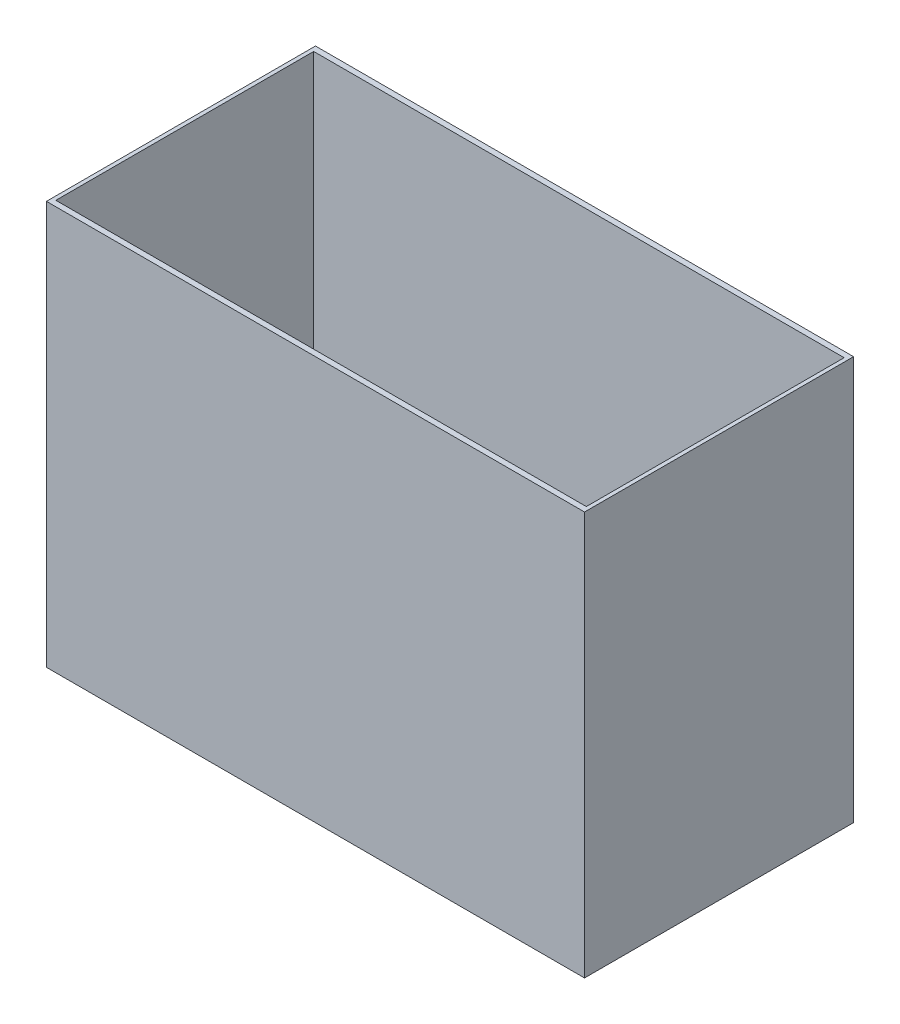
from build123d import *

# Parameters (mm, degrees)
SKETCH1_W           = 584.2
SKETCH1_H           = 279.4
BOSS_EXTRUDE1_DEPTH = 12.7
SKETCH3_W           = 609.6
SKETCH3_H           = 304.8
SKETCH3_W_2         = 600.964
SKETCH3_H_2         = 292.1
BOSS_EXTRUDE3_DEPTH = 457.2
SKETCH4_R           = 2.778125
CUT_EXTRUDE1_DEPTH  = 561.097357608
SKETCH6_R           = 6.35
CUT_EXTRUDE2_DEPTH  = 2.54


with BuildPart() as part:
    # Sketch1 → Boss-Extrude1 (new body)
    with BuildSketch(Plane(origin=(0, 0, 0), x_dir=(1, 0, 0), z_dir=(0, 1, 0))):
        Rectangle(SKETCH1_W, SKETCH1_H)
    extrude(amount=BOSS_EXTRUDE1_DEPTH)

    # Sketch4 → Cut-Extrude1 (cut, through all)
    with BuildSketch(Plane(origin=(0, 12.7, 0), x_dir=(1, 0, 0), z_dir=(0, 1, 0))):
        with Locations((254, 101.6)):
            Circle(SKETCH4_R)
    cut_extrude1 = extrude(amount=-CUT_EXTRUDE1_DEPTH, mode=Mode.SUBTRACT)

    # Sketch6 → Cut-Extrude2 (cut)
    with BuildSketch(Plane.XZ):
        with Locations((254, -101.6)):
            Circle(SKETCH6_R)
    cut_extrude2 = extrude(amount=-CUT_EXTRUDE2_DEPTH, mode=Mode.SUBTRACT)

    # Mirror1: Cut-Extrude1, Cut-Extrude2 across plane
    add(cut_extrude1.mirror(Plane.XY), mode=Mode.SUBTRACT)
    add(cut_extrude2.mirror(Plane.XY), mode=Mode.SUBTRACT)


with BuildPart() as body_2:
    # Sketch3 → Boss-Extrude3 (new body)
    with BuildSketch(Plane(origin=(0, 0, 0), x_dir=(1, 0, 0), z_dir=(0, 1, 0))):
        Rectangle(SKETCH3_W, SKETCH3_H)
        Rectangle(SKETCH3_W_2, SKETCH3_H_2, mode=Mode.SUBTRACT)
    extrude(amount=BOSS_EXTRUDE3_DEPTH)


solid = Compound([part.part, body_2.part])
